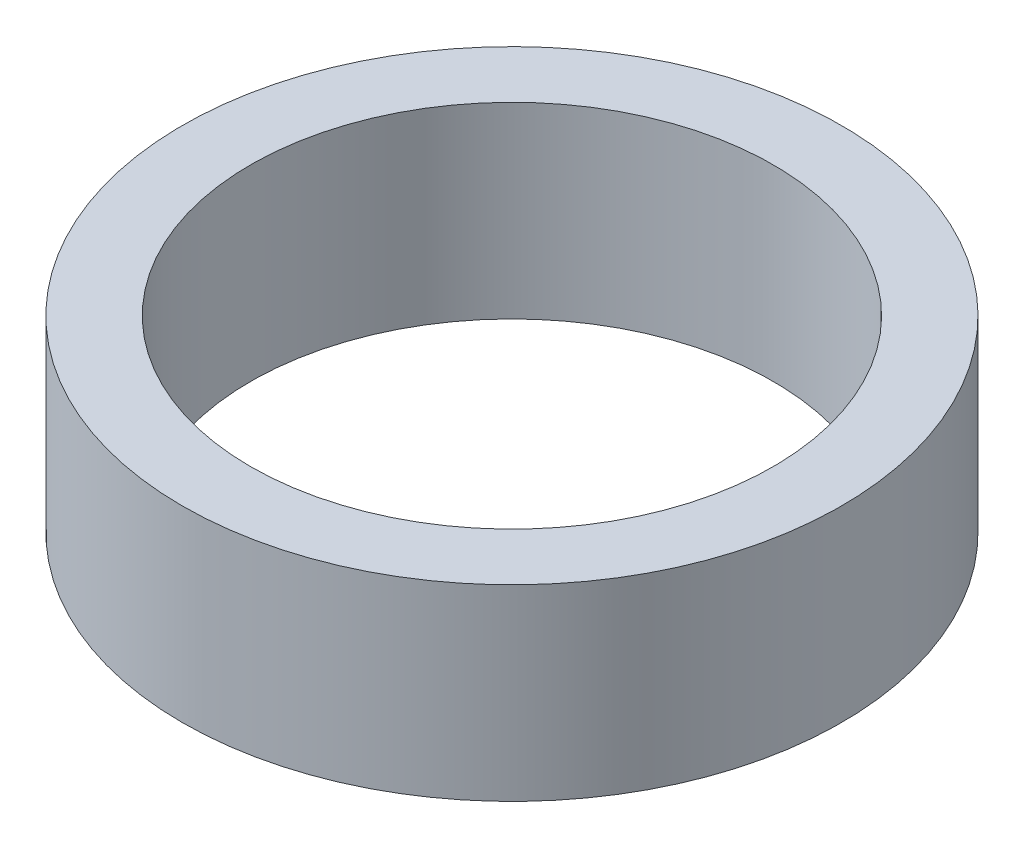
from build123d import *

# Parameters (mm, degrees)
SKETCH1_R           = 290
BOSS_EXTRUDE1_DEPTH = 165.1
SKETCH2_R           = 230
CUT_EXTRUDE1_DEPTH  = 443.106333363


with BuildPart() as part:
    # Sketch1 → Boss-Extrude1 (new body)
    with BuildSketch(Plane(origin=(0, 0, 0), x_dir=(1, 0, 0), z_dir=(0, 1, 0))):
        Circle(SKETCH1_R)
    extrude(amount=BOSS_EXTRUDE1_DEPTH)

    # Sketch2 → Cut-Extrude1 (cut, through all)
    with BuildSketch(Plane(origin=(0, 165.1, 0), x_dir=(1, 0, 0), z_dir=(0, 1, 0))):
        Circle(SKETCH2_R)
    extrude(amount=-CUT_EXTRUDE1_DEPTH, mode=Mode.SUBTRACT)


solid = part.part
